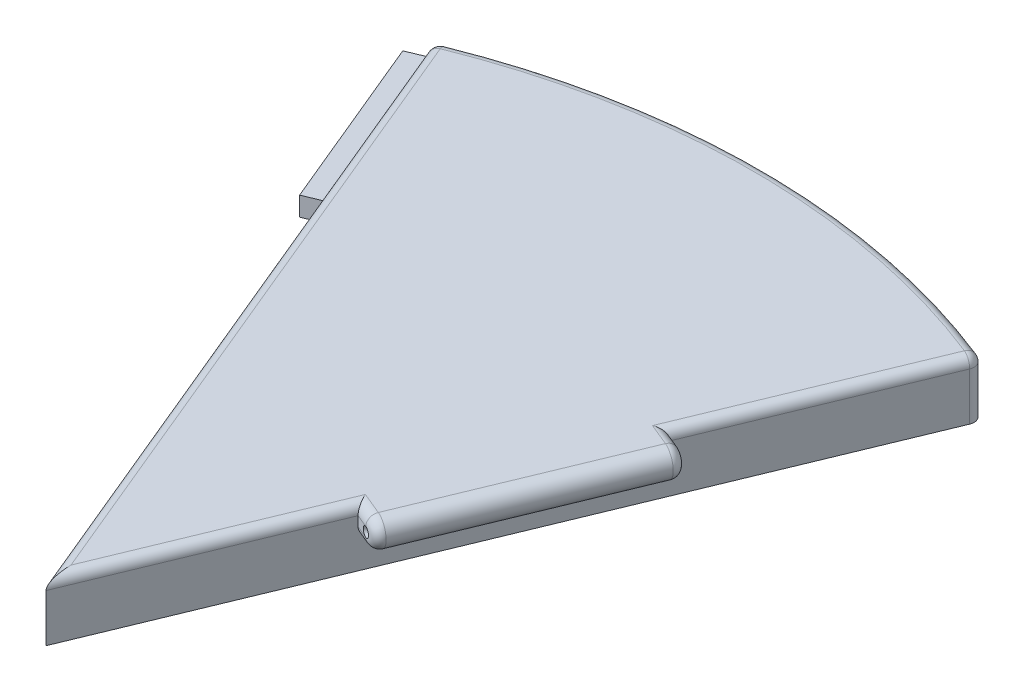
from build123d import *

# Parameters (mm, degrees)
BOSS_EXTRUDE1_DEPTH = 6
SKETCH3_W           = 25
SKETCH3_H           = 3
BOSS_EXTRUDE2_DEPTH = 3
SKETCH4_R           = 0.5
CUT_EXTRUDE2_DEPTH  = 25
CUT_EXTRUDE3_DEPTH  = 25
FILLET1_R           = 1
SKETCH9_W           = 20
SKETCH9_H           = 2
BOSS_EXTRUDE3_DEPTH = 2


with BuildPart() as part:
    # Sketch2 → Boss-Extrude1 (new body)
    with BuildSketch(Plane(origin=(0, 0, 0), x_dir=(1, 0, 0), z_dir=(0, 1, 0))):
        with BuildLine():
            ThreePointArc((-28.776874041, 69.25959515), (-0.08186534, 74.99995532), (28.625606617, 69.322252169))
            Line((28.625606617, 69.322252169), (-28.776874041, 69.25959515))
        make_face()
        Polygon((0, 0), (-28.776874041, 69.25959515), (28.625606617, 69.322252169), align=None)
    extrude(amount=BOSS_EXTRUDE1_DEPTH)

    # Sketch3 → Boss-Extrude2 (add)
    with BuildSketch(Plane(origin=(0, 0, 0), x_dir=(0.3816747548947935, 0, -0.924296695588597), z_dir=(0.9242966955885968, 0, 0.38167475489479347))):
        with Locations((37.5, 4.5)):
            Rectangle(SKETCH3_W, SKETCH3_H)
    extrude(amount=BOSS_EXTRUDE2_DEPTH)

    # Sketch4 → Cut-Extrude2 (cut)
    with BuildSketch(Plane(origin=(9.541868872, 0, -23.10741739), x_dir=(0.9242966955885968, 0, 0.3816747548947936), z_dir=(-0.3816747548947936, 0, 0.9242966955885968))):
        with Locations((1.5, 4.5)):
            Circle(SKETCH4_R)
    extrude(amount=-CUT_EXTRUDE2_DEPTH, mode=Mode.SUBTRACT)

    # Sketch8 → Cut-Extrude3 (cut)
    with BuildSketch(Plane(origin=(9.541868872, 0, -23.10741739), x_dir=(0.9242966955885968, 0, 0.3816747548947936), z_dir=(-0.3816747548947936, 0, 0.9242966955885968))):
        with BuildLine():
            Line((1.5, 6), (3.46050078, 6))
            Line((3.46050078, 6), (3.46050078, 3))
            Line((3.46050078, 3), (1.5, 3))
            ThreePointArc((1.5, 3), (3, 4.5), (1.5, 6))
        make_face()
    extrude(amount=-CUT_EXTRUDE3_DEPTH, mode=Mode.SUBTRACT)

    # Fillet1
    fillet1_edges = [part.edges().sort_by_distance(p)[0] for p in [
        (-14.388437021, 6, -34.629797575),
        (4.770934436, 6, -11.553708695),
        (23.854672181, 6, -57.768543474),
        (19.776960266, 6, -45.928578713),
        (19.776960266, 3, -45.928578713),
        (10.235091394, 3, -22.821161324),
        (10.235091394, 6, -22.821161324),
        (21.856627832, 4.5, -45.069810515),
        (12.314758959, 4.5, -21.962393125),
        (-0.08186534, 6, -74.99995532),
        (28.625606617, 3, -69.322252169),
        (-28.776874041, 3, -69.25959515),
    ]]
    fillet(fillet1_edges, radius=FILLET1_R - 0.0001)  # a hair under: the kernel refuses the full size

    # Sketch9 → Boss-Extrude3 (add)
    with BuildSketch(Plane(origin=(0, 0, 0), x_dir=(0.38369165388519433, 0, 0.9234612686728363), z_dir=(-0.9234612686728362, 0, 0.3836916538851943))):
        with Locations((-63.993242935, 4)):
            Rectangle(SKETCH9_W, SKETCH9_H)
    extrude(amount=BOSS_EXTRUDE3_DEPTH)


solid = part.part
